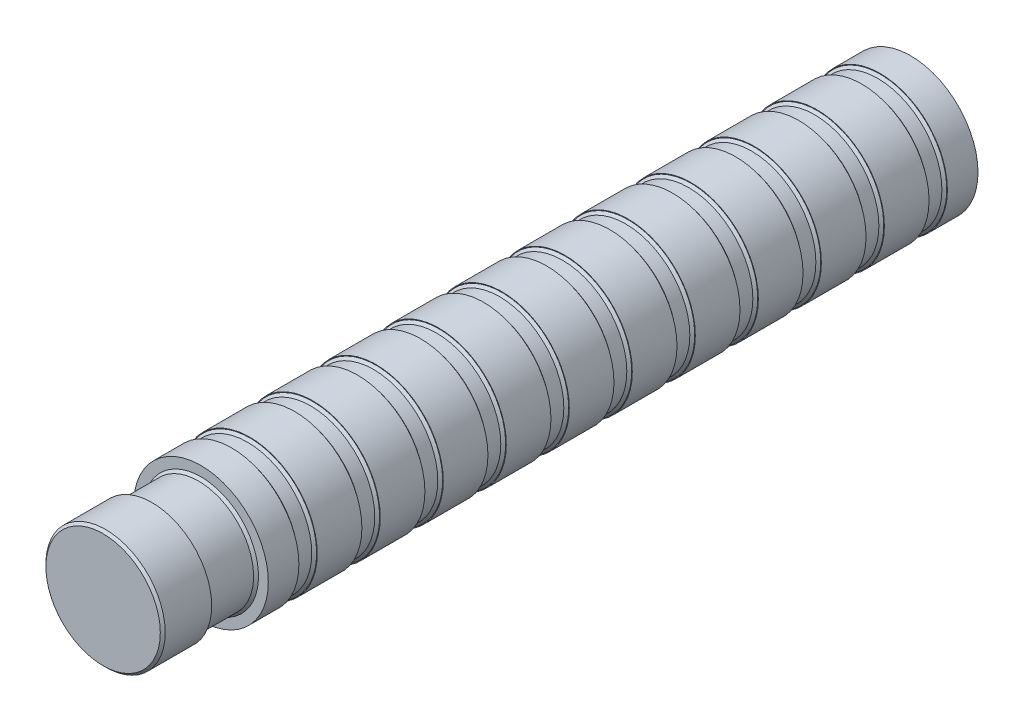
from build123d import *

# Parameters (mm, degrees)
CUT_EXTRUDE1_DEPTH  = 14
SKETCH5_R           = 4.5
BOSS_EXTRUDE1_DEPTH = 4
SKETCH6_R           = 4.875
BOSS_EXTRUDE2_DEPTH = 4
CHAMFER1_SIZE       = 0.2


with BuildPart() as part:
    # Sketch2 → Revolve2 (revolve)
    with BuildSketch(Plane(origin=(0, 0, 0), x_dir=(0, 0, -1), z_dir=(1, 0, 0))):
        Polygon((-29, 0), (29, 0), (29, 5.5), (26.5, 5.5), (26.5, 5.25), (25, 5.25), (25, 5.5), (21.35, 5.5), (21.35, 5.25), (19.85, 5.25), (19.85, 5.5), (16.2, 5.5), (16.2, 5.25), (14.7, 5.25), (14.7, 5.5), (11.05, 5.5), (11.05, 5.25), (9.55, 5.25), (9.55, 5.5), (5.9, 5.5), (5.9, 5.25), (4.4, 5.25), (4.4, 5.5), (0.75, 5.5), (0.75, 5.25), (-0.75, 5.25), (-0.75, 5.5), (-4.4, 5.5), (-4.4, 5.25), (-5.9, 5.25), (-5.9, 5.5), (-9.55, 5.5), (-9.55, 5.25), (-11.05, 5.25), (-11.05, 5.5), (-14.7, 5.5), (-14.7, 5.25), (-16.2, 5.25), (-16.2, 5.5), (-19.85, 5.5), (-19.85, 5.25), (-21.35, 5.25), (-21.35, 5.5), (-25, 5.5), (-25, 5.25), (-26.5, 5.25), (-26.5, 5.5), (-29, 5.5), align=None)
    revolve(axis=Axis((0, 0, -29), (0, 0, -1)))

    # Sketch3 → Cut-Extrude1 (cut)
    with BuildSketch(Plane(origin=(0, 0, -29), x_dir=(-1, 0, 0), z_dir=(0, 0, -1))):
        with BuildLine():
            Line((1.475, 1.529705854), (1.475, -1.529705854))
            ThreePointArc((1.475, -1.529705854), (-2.125, 0), (1.475, 1.529705854))
        make_face()
    extrude(amount=-CUT_EXTRUDE1_DEPTH, mode=Mode.SUBTRACT)

    # Sketch5 → Boss-Extrude1 (add)
    with BuildSketch(Plane.XY.offset(29)):
        Circle(SKETCH5_R)
    extrude(amount=BOSS_EXTRUDE1_DEPTH)

    # Sketch6 → Boss-Extrude2 (add)
    with BuildSketch(Plane.XY.offset(33)):
        Circle(SKETCH6_R)
    extrude(amount=BOSS_EXTRUDE2_DEPTH)

    # Chamfer1
    chamfer1_edges = [part.edges().sort_by_distance(p)[0] for p in [
        (-4.875, 0, 37),
        (-4.5, 0, 29),
        (-4.5, 0, 33),
        (0, -5.25, 26.5),
        (0, -5.25, 25),
        (0, -5.25, 19.85),
        (0, -5.25, 21.35),
        (0, -5.25, -26.5),
        (0, -5.25, -25),
        (0, -5.25, -21.35),
        (0, -5.25, -19.85),
        (0, -5.25, -16.2),
        (0, -5.25, -14.7),
        (0, -5.25, -11.05),
        (0, -5.25, -9.55),
        (0, -5.25, -5.9),
        (0, -5.25, -4.4),
        (0, -5.25, -0.75),
        (0, -5.25, 0.75),
        (0, -5.25, 4.4),
        (0, -5.25, 5.9),
        (0, -5.25, 9.55),
        (0, -5.25, 11.05),
        (0, -5.25, 14.7),
        (0, -5.25, 16.2),
    ]]
    chamfer(chamfer1_edges, length=CHAMFER1_SIZE)


solid = part.part
